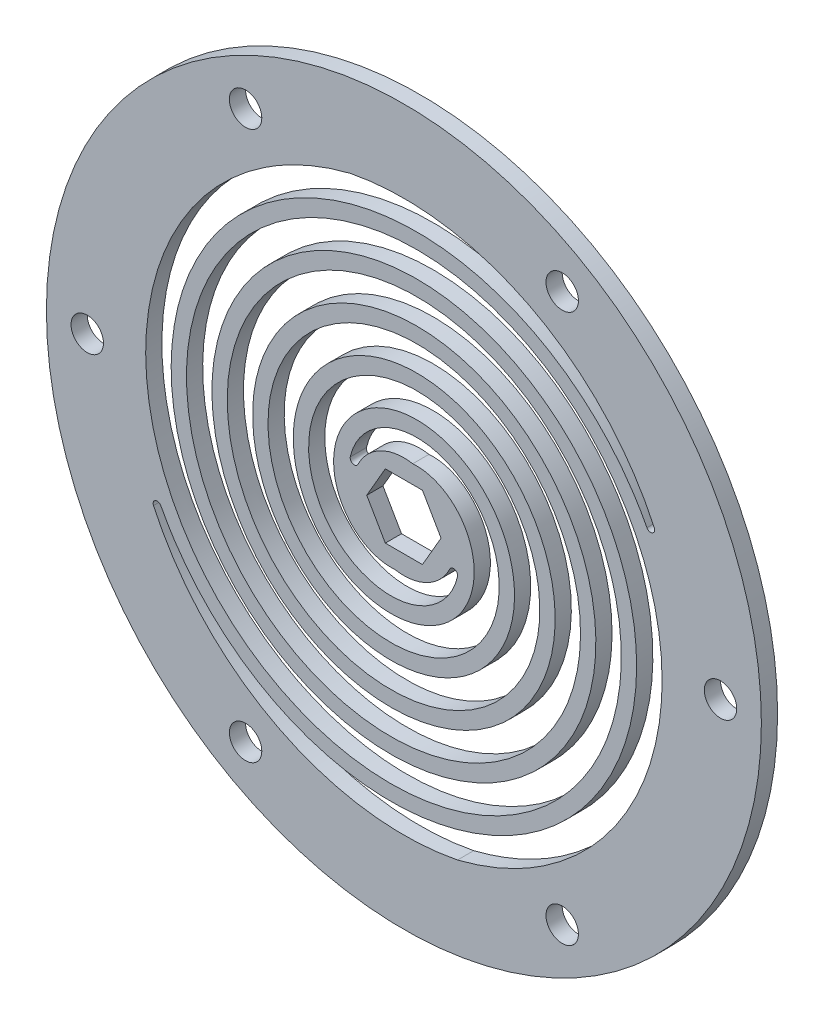
from build123d import *

# Parameters (mm, degrees)
SKETCH3_R                   = 35
SKETCH3_R_2                 = 1.5875
SKETCH3_R_3                 = 27
BODY_EXTRUDE_DEPTH          = 0.79375
SKETCH3_R_4                 = 5
BODY_EXTRUDE_2_DEPTH        = 0.79375
SPRING_START                = -0.79375
SPRING_ARM_DEPTH            = 1.5875
SPRING_ARM_PATTERN_COUNT    = 2
HEXSHAFT_PROFILE_DEPTH      = 50.503838773
HEXSHAFT_PROFILE_DEPTH_BACK = 50.503838773
FILLET1_R                   = 0.4


# Read off the part's stored shape, not the designer's step: Spring Arm
with BuildPart() as part:
    # Sketch3 → Body Extrude (new, symmetric)
    with BuildSketch(Plane.XY):
        Circle(SKETCH3_R)
        with Locations((-15.5, -26.846787517)):
            Circle(SKETCH3_R_2, mode=Mode.SUBTRACT)
        with Locations((15.5, -26.846787517)):
            Circle(SKETCH3_R_2, mode=Mode.SUBTRACT)
        with Locations((31, 0)):
            Circle(SKETCH3_R_2, mode=Mode.SUBTRACT)
        with Locations((15.5, 26.846787517)):
            Circle(SKETCH3_R_2, mode=Mode.SUBTRACT)
        with Locations((-15.5, 26.846787517)):
            Circle(SKETCH3_R_2, mode=Mode.SUBTRACT)
        with Locations((-31, 0)):
            Circle(SKETCH3_R_2, mode=Mode.SUBTRACT)
        Circle(SKETCH3_R_3, mode=Mode.SUBTRACT)
    extrude(amount=BODY_EXTRUDE_DEPTH, both=True)



with BuildPart() as body_2:
    # Sketch3 → Body Extrude 2 (new, symmetric)
    with BuildSketch(Plane.XY):
        Circle(SKETCH3_R_4)
    extrude(amount=BODY_EXTRUDE_2_DEPTH, both=True)


with BuildPart() as part_1:
    add(part.part)

    add(body_2.part)  # Spring Arm merges body 2
    # Spring Arm outline → Spring Arm (add)
    with BuildSketch(Plane.XY.offset(SPRING_START)):
        with BuildLine():
            ThreePointArc((-0.867861894, -4.924105577), (-3.526376228, -3.544667925), (-4.919549657, -0.893325907))
            add(Edge.make_bspline(
                [(-4.919549657, -0.893325907), (-5.035139388, -0.641919498), (-5.131709316, -0.375756981), (-5.361295032, 0.486137391), (-5.417680962, 1.126357257), (-5.290416934, 2.428911789), (-5.105965726, 3.096831999), (-4.489272727, 4.362574525), (-4.054382912, 4.96524635), (-2.964859955, 6.006805281), (-2.306133521, 6.449248378), (-0.832362171, 7.089044876), (-0.012330206, 7.288280373), (1.690962994, 7.385930436), (2.579471904, 7.284384808), (4.307492624, 6.760866553), (5.151872935, 6.337145685), (6.674419609, 5.192000244), (7.356502124, 4.467301988), (8.448233484, 2.785928777), (8.860403189, 1.824888526), (9.332774958, -0.225760629), (9.393836955, -1.320276755), (9.124315308, -3.507760287), (8.792867978, -4.605578306), (7.747163105, -6.65830547), (7.030460294, -7.617432071), (5.274254891, -9.258294583), (4.231050456, -9.94312677), (1.928949512, -10.926265462), (0.665560247, -11.226202327), (-1.933388926, -11.372095887), (-3.273683779, -11.218052524), (-5.862763511, -10.442081424), (-7.115959687, -9.818554213), (-9.36698773, -8.148812786), (-10.36839084, -7.099618448), (-11.973084065, -4.68096584), (-12.578697823, -3.307523935), (-13.290005352, -0.390542521), (-13.396522078, 1.157495883), (-13.064474828, 4.242032351), (-12.62516122, 5.783004489), (-11.2222305, 8.661607126), (-10.256405559, 10.003159201), (-7.888489937, 12.304801636), (-6.483017185, 13.267807416), (-3.383864266, 14.671344755), (-1.686045071, 15.113457829), (1.805035116, 15.391269163), (3.602692657, 15.227049467), (7.077806195, 14.279087484), (8.759394589, 13.493941099), (11.789724882, 11.367337363), (13.141852637, 10.023177512), (15.33043438, 6.914185976), (16.169140504, 5.145690726), (17.202266897, 1.38287041), (17.397557493, -0.615634258), (17.088225393, -4.605747671), (16.583009129, -6.601553187), (14.900530643, -10.342750717), (13.721301951, -12.091863267), (10.80271393, -15.115076098), (9.060265995, -16.391990498), (5.201288577, -18.293837624), (3.080927098, -18.920360563), (-1.293287895, -19.416151545), (-3.551256367, -19.285616623), (-7.932789495, -18.249929052), (-10.060265137, -17.343576858), (-13.917405677, -14.832811242), (-15.650321595, -13.225962118), (-18.492008164, -9.479314161), (-19.602997798, -7.336146535), (-21.040922713, -2.753998271), (-21.368799173, -0.311123878), (-21.169366606, 4.587363247), (-20.641628463, 7.04693084), (-18.760924412, 11.682577738), (-17.406228506, 13.862208576), (-14.003018228, 17.664291195), (-11.951693844, 19.289480574), (-7.376007562, 21.765819095), (-4.848099931, 22.618582458), (0.394094513, 23.418659049), (3.112237153, 23.366289645), (8.414798758, 22.32936327), (11.002927689, 21.343807688), (15.729620523, 18.525566255), (17.871316076, 16.690701089), (21.432100141, 12.364415808), (22.853383346, 9.869907312), (24.777775557, 4.501057954), (25.281898422, 1.623093907), (25.280314788, -4.180337113), (24.774339128, -7.109530467), (22.779505331, -12.665835148), (21.289556312, -15.295838522), (18.425967678, -18.771954407), (17.367211894, -19.853353072), (15.070336736, -21.825711104), (13.831759048, -22.717052909), (11.20941861, -24.279535189), (9.825139221, -24.950973672), (7.366193018, -25.891091808), (6.317487188, -26.220196193), (5.249610203, -26.48474264)],
                knots=[0.133206793, 0.133206793, 0.133206793, 0.133206793, 0.140625, 0.140625, 0.15625, 0.15625, 0.171875, 0.171875, 0.1875, 0.1875, 0.203125, 0.203125, 0.21875, 0.21875, 0.234375, 0.234375, 0.25, 0.25, 0.265625, 0.265625, 0.28125, 0.28125, 0.296875, 0.296875, 0.3125, 0.3125, 0.328125, 0.328125, 0.34375, 0.34375, 0.359375, 0.359375, 0.375, 0.375, 0.390625, 0.390625, 0.40625, 0.40625, 0.421875, 0.421875, 0.4375, 0.4375, 0.453125, 0.453125, 0.46875, 0.46875, 0.484375, 0.484375, 0.5, 0.5, 0.515625, 0.515625, 0.53125, 0.53125, 0.546875, 0.546875, 0.5625, 0.5625, 0.578125, 0.578125, 0.59375, 0.59375, 0.609375, 0.609375, 0.625, 0.625, 0.640625, 0.640625, 0.65625, 0.65625, 0.671875, 0.671875, 0.6875, 0.6875, 0.703125, 0.703125, 0.71875, 0.71875, 0.734375, 0.734375, 0.75, 0.75, 0.765625, 0.765625, 0.78125, 0.78125, 0.796875, 0.796875, 0.8125, 0.8125, 0.828125, 0.828125, 0.84375, 0.84375, 0.859375, 0.859375, 0.875, 0.875, 0.890625, 0.890625, 0.8984375, 0.8984375, 0.90625, 0.90625, 0.9140625, 0.9140625, 0.919615511, 0.919615511, 0.919615511, 0.919615511], degree=3))
            ThreePointArc((5.249610203, -26.48474264), (19.085525799, -19.098238268), (26.481241278, -5.267244096))
            add(Edge.make_bspline(
                [(-0.867861894, -4.924105577), (-1.347794813, -4.958698067), (-1.846344128, -4.923237348), (-2.972239834, -4.668823596), (-3.593058666, -4.406566562), (-4.741233039, -3.640969113), (-5.262774677, -3.141171252), (-6.120552393, -1.940130982), (-6.452699484, -1.244139576), (-6.85745475, 0.275363867), (-6.928117865, 1.092638472), (-6.765762801, 2.754351752), (-6.533098364, 3.592363987), (-5.759068415, 5.181035536), (-5.220240455, 5.925865645), (-3.872053435, 7.214701481), (-3.06705221, 7.754165845), (-1.26609263, 8.536001937), (-0.275747288, 8.775641668), (1.78267156, 8.89365114), (2.844575612, 8.771396274), (4.91222181, 8.144985655), (5.911988684, 7.642357862), (7.717562894, 6.284340331), (8.518305049, 5.432422476), (9.802555159, 3.454551536), (10.282507364, 2.333579319), (10.834111191, -0.061030172), (10.904131329, -1.328785905), (10.591505603, -3.866109474), (10.209336467, -5.129604484), (9.003825779, -7.49603176), (8.183002637, -8.593426936), (6.169826055, -10.474383444), (4.98172509, -11.253603057), (2.356512434, -12.374730323), (0.924875832, -12.714007037), (-2.02456244, -12.879575511), (-3.536320916, -12.705258454), (-6.461403412, -11.828584224), (-7.868836451, -11.1277117), (-10.401392044, -9.249142038), (-11.521477174, -8.074846498), (-13.319835565, -5.364294634), (-13.99452487, -3.832953564), (-14.788774131, -0.575838694), (-14.906631547, 1.144088657), (-14.53713253, 4.576531464), (-14.050160574, 6.282962323), (-12.494003543, 9.475962283), (-11.427248864, 10.956930692), (-8.808649331, 13.5022409), (-7.26099758, 14.562131918), (-3.843514344, 16.109833969), (-1.979146358, 16.594875505), (1.860156313, 16.900397504), (3.829000875, 16.720123588), (7.641008134, 15.680261747), (9.478173753, 14.822031037), (12.794253458, 12.494896103), (14.267974416, 11.029307807), (16.657444809, 7.634943741), (17.569423331, 5.711057675), (18.694924176, 1.611794052), (18.906550217, -0.55769236), (18.570257997, -4.895567727), (18.022550719, -7.057756978), (16.197043703, -11.116996012), (14.921546813, -13.00826968), (11.760807613, -16.282314263), (9.879697441, -17.660417862), (5.708055711, -19.716357552), (3.423005785, -20.391192397), (-1.29749796, -20.926233127), (-3.726761998, -20.785466902), (-8.447393336, -19.669624785), (-10.732590684, -18.695731101), (-14.8817056, -15.994907795), (-16.740202195, -14.271186158), (-19.792385091, -10.24700737), (-20.98204375, -7.951415688), (-22.524246954, -3.036970112), (-22.87464035, -0.424073401), (-22.661042182, 4.822350951), (-22.097040183, 7.449527209), (-20.085440647, 12.407811395), (-18.639986415, 14.732921417), (-15.004590721, 18.794402681), (-12.81870532, 20.52583945), (-7.936883283, 23.16785711), (-5.246447557, 24.075155308), (0.339816073, 24.927744583), (3.229339089, 24.871801492), (8.873447496, 23.768084967), (11.621663241, 22.721283251), (16.647241616, 19.724834424), (18.918920826, 17.778263058), (22.700821753, 13.183324973), (24.206720584, 10.539787525), (26.248504925, 4.843426628), (26.781945832, 1.796626769), (26.78074361, -2.609068555), (26.680417985, -3.943284449), (26.481241278, -5.267244096)],
                knots=[0.081305012, 0.081305012, 0.081305012, 0.081305012, 0.09375, 0.09375, 0.109375, 0.109375, 0.125, 0.125, 0.140625, 0.140625, 0.15625, 0.15625, 0.171875, 0.171875, 0.1875, 0.1875, 0.203125, 0.203125, 0.21875, 0.21875, 0.234375, 0.234375, 0.25, 0.25, 0.265625, 0.265625, 0.28125, 0.28125, 0.296875, 0.296875, 0.3125, 0.3125, 0.328125, 0.328125, 0.34375, 0.34375, 0.359375, 0.359375, 0.375, 0.375, 0.390625, 0.390625, 0.40625, 0.40625, 0.421875, 0.421875, 0.4375, 0.4375, 0.453125, 0.453125, 0.46875, 0.46875, 0.484375, 0.484375, 0.5, 0.5, 0.515625, 0.515625, 0.53125, 0.53125, 0.546875, 0.546875, 0.5625, 0.5625, 0.578125, 0.578125, 0.59375, 0.59375, 0.609375, 0.609375, 0.625, 0.625, 0.640625, 0.640625, 0.65625, 0.65625, 0.671875, 0.671875, 0.6875, 0.6875, 0.703125, 0.703125, 0.71875, 0.71875, 0.734375, 0.734375, 0.75, 0.75, 0.765625, 0.765625, 0.78125, 0.78125, 0.796875, 0.796875, 0.8125, 0.8125, 0.828125, 0.828125, 0.84375, 0.84375, 0.859375, 0.859375, 0.866131876, 0.866131876, 0.866131876, 0.866131876], degree=3))
        make_face()
    spring_arm = extrude(amount=SPRING_ARM_DEPTH)

    # Spring Arm Pattern: Spring Arm ×2 about axis
    spring_arm_pattern_axis = Axis((0, 0, 0), (0, 0, 1))
    for i in range(1, SPRING_ARM_PATTERN_COUNT):
        add(spring_arm.rotate(spring_arm_pattern_axis, i * 360 / SPRING_ARM_PATTERN_COUNT))

    # Sketch10 → Hexshaft Profile (cut, two sides: drawn at the far end of the back side and taken through both)
    with BuildSketch(Plane.XY.offset(-HEXSHAFT_PROFILE_DEPTH_BACK)):
        Polygon((3.637306696, 0), (1.818653348, 3.15), (-1.818653348, 3.15), (-3.637306696, 0), (-1.818653348, -3.15), (1.818653348, -3.15), align=None)
    extrude(amount=HEXSHAFT_PROFILE_DEPTH + HEXSHAFT_PROFILE_DEPTH_BACK, mode=Mode.SUBTRACT)

    # Fillet1
    fillet1_edges = [part_1.edges().sort_by_distance(p)[0] for p in [
        (-4.919549657, -0.893325907, 0),
        (4.919549657, 0.893325907, 0),
        (26.481241278, -5.267244096, 0),
        (-26.481241278, 5.267244096, 0),
    ]]
    fillet(fillet1_edges, radius=FILLET1_R)


solid = part_1.part
